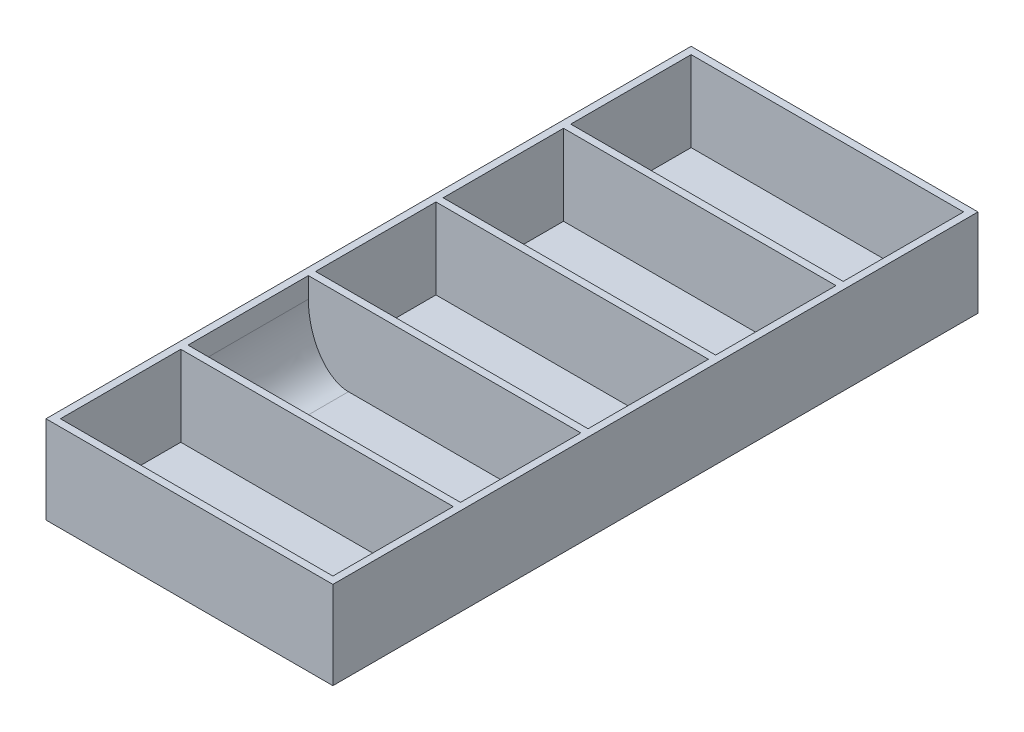
from build123d import *

# Parameters (mm, degrees)
SKETCH1_W           = 71.6
SKETCH1_H           = 161
SKETCH1_W_2         = 68
SKETCH1_H_2         = 30.04
BOSS_EXTRUDE1_DEPTH = 1.8
SKETCH1_6_W         = 71.6
SKETCH1_6_H         = 161
SKETCH1_6_W_2       = 68
SKETCH1_6_H_2       = 30.04
BOSS_EXTRUDE2_DEPTH = 20.1
FILLET3_SIZE        = 15
FILLET3_SIZE_2      = 10
FILLET4_R           = 15
FILLET5_SIZE        = 20
FILLET5_SIZE_2      = 15
FILLET6_SIZE        = 10
FILLET6_SIZE_2      = 15
FILLET7_SIZE        = 10
FILLET7_SIZE_2      = 15


with BuildPart() as part:
    # Sketch1 → Boss-Extrude1 (new body)
    # profile 1 of 6: a face of its own
    with BuildSketch(Plane(origin=(0, 0, 0), x_dir=(1, 0, 0), z_dir=(0, 1, 0))):
        with Locations((35.8, 80.5)):
            Rectangle(SKETCH1_W, SKETCH1_H)
        with Locations((35.8, 48.66)):
            Rectangle(SKETCH1_W_2, SKETCH1_H_2, mode=Mode.SUBTRACT)
        with Locations((35.8, 16.82)):
            Rectangle(SKETCH1_W_2, SKETCH1_H_2, mode=Mode.SUBTRACT)
        with Locations((35.8, 80.5)):
            Rectangle(SKETCH1_W_2, SKETCH1_H_2, mode=Mode.SUBTRACT)
        with Locations((35.8, 112.34)):
            Rectangle(SKETCH1_W_2, SKETCH1_H_2, mode=Mode.SUBTRACT)
        with Locations((35.8, 144.18)):
            Rectangle(SKETCH1_W_2, SKETCH1_H_2, mode=Mode.SUBTRACT)
    # profile 2 of 6: a face of its own
    with BuildSketch(Plane(origin=(0, 0, 0), x_dir=(1, 0, 0), z_dir=(0, 1, 0))):
        with Locations((35.8, 144.18)):
            Rectangle(SKETCH1_W_2, SKETCH1_H_2)
    # profile 3 of 6: a face of its own
    with BuildSketch(Plane(origin=(0, 0, 0), x_dir=(1, 0, 0), z_dir=(0, 1, 0))):
        with Locations((35.8, 112.34)):
            Rectangle(SKETCH1_W_2, SKETCH1_H_2)
    # profile 4 of 6: a face of its own
    with BuildSketch(Plane(origin=(0, 0, 0), x_dir=(1, 0, 0), z_dir=(0, 1, 0))):
        with Locations((35.8, 80.5)):
            Rectangle(SKETCH1_W_2, SKETCH1_H_2)
    # profile 5 of 6: a face of its own
    with BuildSketch(Plane(origin=(0, 0, 0), x_dir=(1, 0, 0), z_dir=(0, 1, 0))):
        with Locations((35.8, 48.66)):
            Rectangle(SKETCH1_W_2, SKETCH1_H_2)
    # profile 6 of 6: a face of its own
    with BuildSketch(Plane(origin=(0, 0, 0), x_dir=(1, 0, 0), z_dir=(0, 1, 0))):
        with Locations((35.8, 16.82)):
            Rectangle(SKETCH1_W_2, SKETCH1_H_2)
    extrude(amount=-BOSS_EXTRUDE1_DEPTH)

    # Sketch1<6> → Boss-Extrude2 (add)
    with BuildSketch(Plane(origin=(0, 0, 0), x_dir=(1, 0, 0), z_dir=(0, 1, 0))):
        with Locations((35.8, 80.5)):
            Rectangle(SKETCH1_6_W, SKETCH1_6_H)
        with Locations((35.8, 16.82)):
            Rectangle(SKETCH1_6_W_2, SKETCH1_6_H_2, mode=Mode.SUBTRACT)
        with Locations((35.8, 80.5)):
            Rectangle(SKETCH1_6_W_2, SKETCH1_6_H_2, mode=Mode.SUBTRACT)
        with Locations((35.8, 48.66)):
            Rectangle(SKETCH1_6_W_2, SKETCH1_6_H_2, mode=Mode.SUBTRACT)
        with Locations((35.8, 112.34)):
            Rectangle(SKETCH1_6_W_2, SKETCH1_6_H_2, mode=Mode.SUBTRACT)
        with Locations((35.8, 144.18)):
            Rectangle(SKETCH1_6_W_2, SKETCH1_6_H_2, mode=Mode.SUBTRACT)
    extrude(amount=BOSS_EXTRUDE2_DEPTH)

    # Fillet3
    # an asymmetric fillet: 15, 10 mm, written as the material it adds along each edge
    with BuildSketch(Plane(origin=(69.8, 0, -159.2), x_dir=(0, 1, 0), z_dir=(0, 0, 1))) as fillet3_piece_1_section:
        with BuildLine():
            Bezier((FILLET3_SIZE, 0), (0, 0), (0, FILLET3_SIZE_2), weights=[1, 0.707106781, 1])
            Line((0, FILLET3_SIZE_2), (0, 0))
            Line((0, 0), (FILLET3_SIZE, 0))
        make_face()
    fillet3_piece_1 = extrude(amount=67.54, mode=Mode.PRIVATE)
    fillet3_piece_1 = split(fillet3_piece_1, bisect_by=Plane(origin=(67.566321176, 3.350519055, -127.36), z_dir=(0, 0, -1)), keep=Keep.TOP, mode=Mode.PRIVATE)
    add(fillet3_piece_1)

    # Fillet4
    fillet4_edges = [part.edges().sort_by_distance(p)[0] for p in [
        (69.8, 0, -112.34),
    ]]
    fillet(fillet4_edges, radius=FILLET4_R)

    # Fillet5
    # an asymmetric fillet: 20, 15 mm, written as the material it adds along each edge
    with BuildSketch(Plane(origin=(69.8, 0, -95.52), x_dir=(0, 1, 0), z_dir=(0, 0, 1))) as fillet5_piece_1_section:
        with BuildLine():
            Bezier((FILLET5_SIZE, 0), (0, 0), (0, FILLET5_SIZE_2), weights=[1, 0.707106781, 1])
            Line((0, FILLET5_SIZE_2), (0, 0))
            Line((0, 0), (FILLET5_SIZE, 0))
        make_face()
    fillet5_piece_1 = extrude(amount=80.04, mode=Mode.PRIVATE)
    fillet5_piece_1 = split(fillet5_piece_1, bisect_by=Plane(origin=(69.753885797, 17.321244921, -63.68), z_dir=(0, 0, -1)), keep=Keep.TOP, mode=Mode.PRIVATE)
    add(fillet5_piece_1)

    # Fillet6
    # an asymmetric fillet: 15, 10 mm, written as the material it adds along each edge
    with BuildSketch(Plane(origin=(1.8, 0, -101.18), x_dir=(1, 0, 0), z_dir=(0, 0, 1))) as fillet6_piece_1_section:
        with BuildLine():
            Bezier((FILLET6_SIZE, 0), (0, 0), (0, FILLET6_SIZE_2), weights=[1, 0.707106781, 1])
            Line((0, FILLET6_SIZE_2), (0, 0))
            Line((0, 0), (FILLET6_SIZE, 0))
        make_face()
    fillet6_piece_1 = extrude(amount=105.04, mode=Mode.PRIVATE)
    fillet6_piece_1 = split(fillet6_piece_1, bisect_by=Plane(origin=(4.033678617, 3.350518679, -31.84), z_dir=(0, 0, -1)), keep=Keep.TOP, mode=Mode.PRIVATE)
    fillet6_piece_1 = split(fillet6_piece_1, bisect_by=Plane(origin=(4.033678617, 3.350518679, -65.48), z_dir=(0, 0, 1)), keep=Keep.TOP, mode=Mode.PRIVATE)
    add(fillet6_piece_1)

    # Fillet7
    # an asymmetric fillet: 15, 10 mm, written as the material it adds along each edge
    with BuildSketch(Plane(origin=(69.8, 0, 3.86), x_dir=(-1, 0, 0), z_dir=(0, 0, -1))) as fillet7_piece_1_section:
        with BuildLine():
            Bezier((FILLET7_SIZE, 0), (0, 0), (0, FILLET7_SIZE_2), weights=[1, 0.707106781, 1])
            Line((0, FILLET7_SIZE_2), (0, 0))
            Line((0, 0), (FILLET7_SIZE, 0))
        make_face()
    fillet7_piece_1 = extrude(amount=105.04, mode=Mode.PRIVATE)
    fillet7_piece_1 = split(fillet7_piece_1, bisect_by=Plane(origin=(67.566321383, 3.350518679, -31.84), z_dir=(0, 0, -1)), keep=Keep.TOP, mode=Mode.PRIVATE)
    add(fillet7_piece_1)


solid = part.part
